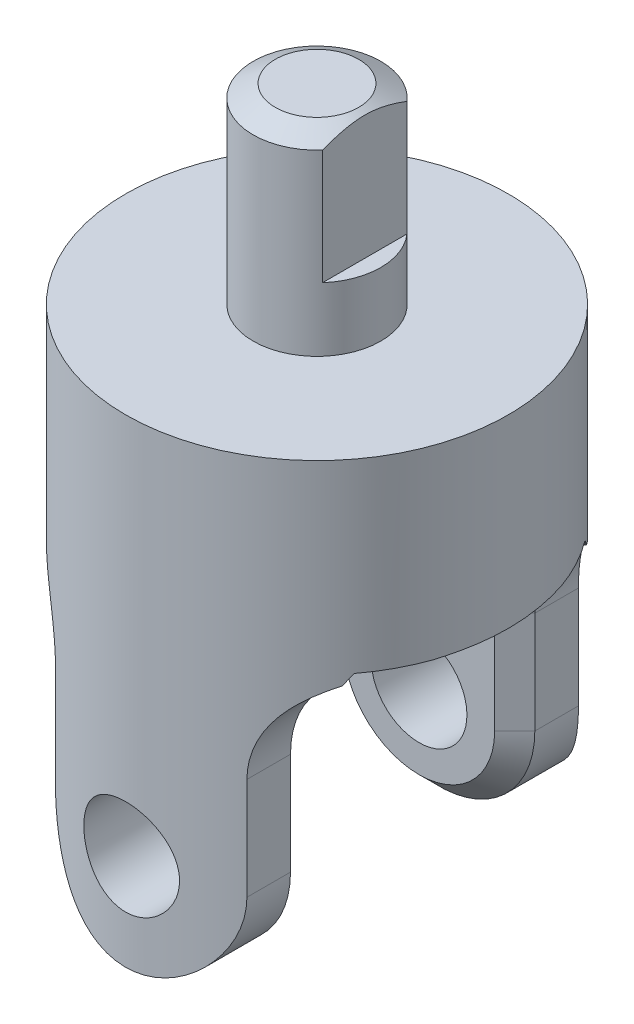
from build123d import *

# Parameters (mm, degrees)
SKETCH1_R               = 19.05
BASE_EXTRUDE_DEPTH      = 47.625
CUT_EXTRUDE1_DEPTH      = 55.716959208
CUT_EXTRUDE1_DEPTH_BACK = 55.716959208
CUT_EXTRUDE5_DEPTH      = 47.625
CUT_EXTRUDE5_DEPTH_BACK = 55.716959365
SKETCH8_W               = 20.32
SKETCH8_H               = 36.600526062
CUT_EXTRUDE6_DEPTH      = 55.716959365
CUT_EXTRUDE6_DEPTH_BACK = 55.716959365
SKETCH11_R              = 4.7625
SKETCH12_R              = 6.35
BOSS_EXTRUDE1_DEPTH     = 19.05
CHAMFER3_SIZE           = 1.27
CHAMFER3_SIZE2          = 2.199704526
CUT_EXTRUDE7_START      = -12.7
CUT_EXTRUDE7_DEPTH      = 12.7
CHAMFER4_SIZE           = 2


with BuildPart() as part:
    # Sketch1 → Base-Extrude (new body)
    with BuildSketch(Plane(origin=(0, 0, 0), x_dir=(-1, 0, 0), z_dir=(0, 1, 0))):
        with Locations(Location((0, 0, 0), (0, 0, 90))):
            Circle(SKETCH1_R)
    extrude(amount=BASE_EXTRUDE_DEPTH)

    # Sketch2 → Cut-Extrude1 (cut, two sides: drawn at the far end of the back side and taken through both)
    with BuildSketch(Plane.XY.offset(-CUT_EXTRUDE1_DEPTH_BACK)):
        with BuildLine():
            Line((9.525, 9.525), (9.525, 19.685))
            ThreePointArc((9.525, 19.685), (12.314807909, 26.420192091), (19.05, 29.21))
            Line((19.05, 29.21), (19.05, -1.366191125))
            Line((19.05, -1.366191125), (-19.05, -1.366191125))
            Line((-19.05, -1.366191125), (-19.05, 29.21))
            ThreePointArc((-19.05, 29.21), (-12.314807909, 26.420192091), (-9.525, 19.685))
            Line((-9.525, 19.685), (-9.525, 9.525))
            ThreePointArc((-9.525, 9.525), (0, 0), (9.525, 9.525))
        make_face()
    extrude(amount=CUT_EXTRUDE1_DEPTH + CUT_EXTRUDE1_DEPTH_BACK, mode=Mode.SUBTRACT)

    # Sketch8 → Cut-Extrude5 (cut, two sides: drawn at the far end of the back side and taken through both)
    with BuildSketch(Plane(origin=(0, 0, 0), x_dir=(0, 0, -1), z_dir=(1, 0, 0)).offset(-CUT_EXTRUDE5_DEPTH_BACK)):
        with Locations((0, 10.844975795)):
            Rectangle(SKETCH8_W, SKETCH8_H)
    extrude(amount=CUT_EXTRUDE5_DEPTH + CUT_EXTRUDE5_DEPTH_BACK, mode=Mode.SUBTRACT)

    # Sketch11 → Cut-Extrude6 (cut, two sides: drawn at the far end of the back side and taken through both)
    with BuildSketch(Plane.XY.offset(-CUT_EXTRUDE6_DEPTH_BACK)):
        with Locations(Location((0, 9.525, 0), (0, 0, 270))):
            Circle(SKETCH11_R)
    extrude(amount=CUT_EXTRUDE6_DEPTH + CUT_EXTRUDE6_DEPTH_BACK, mode=Mode.SUBTRACT)

    # Sketch12 → Boss-Extrude1 (add)
    with BuildSketch(Plane(origin=(0, 47.625, 0), x_dir=(-1, 0, 0), z_dir=(0, 1, 0))):
        with Locations(Location((0, 0, 0), (0, 0, 270))):
            Circle(SKETCH12_R)
    extrude(amount=BOSS_EXTRUDE1_DEPTH)

    # Chamfer3
    chamfer3_edges = [part.edges().sort_by_distance(p)[0] for p in [
        (0, 66.675, 6.35),
    ]]
    chamfer3_side = [part.faces().sort_by_distance(p)[0] for p in [
        (0, 57.15, 6.35),
    ]]
    chamfer(chamfer3_edges, length=CHAMFER3_SIZE, length2=CHAMFER3_SIZE2, reference=chamfer3_side[0])

    # Sketch13 → Cut-Extrude7 (cut)
    with BuildSketch(Plane(origin=(0, 66.675, 0), x_dir=(-1, 0, 0), z_dir=(0, 1, 0)).offset(CUT_EXTRUDE7_START)):
        with BuildLine():
            Line((-4.7625, 4.200130206), (-4.7625, -4.200130206))
            ThreePointArc((-4.7625, -4.200130206), (-6.35, 0), (-4.7625, 4.200130206))
        make_face()
    extrude(amount=CUT_EXTRUDE7_DEPTH, mode=Mode.SUBTRACT)

    # Chamfer4
    # the kernel refuses this chamfer: 2 mm, written as the material it takes off along each edge
    with BuildSketch(Plane(origin=(-19.05, 19.685, -10.16), x_dir=(-0.22489517574669296, 0.974382963688233, 0), z_dir=(-0.974382963688233, -0.22489517574669296, 0))) as chamfer4_piece_1_section:
        Polygon((9.525 + CHAMFER4_SIZE, 0), (9.525, CHAMFER4_SIZE), (9.525, 0), align=None)
    chamfer4_piece_1 = revolve(axis=Axis((-19.05, 19.685, -10.16), (0, 0, -1)), revolution_arc=102.996714199, mode=Mode.PRIVATE)
    chamfer4_piece_1 = split(chamfer4_piece_1, bisect_by=Plane(origin=(-11.833499513, 29.145238826, -10.859553491), z_dir=(0, -1, 0)), keep=Keep.TOP, mode=Mode.PRIVATE)
    add(chamfer4_piece_1, mode=Mode.SUBTRACT)
    with BuildSketch(Plane(origin=(-9.525, 19.685, -10.16), x_dir=(0.9996219169112968, 0, 0.027495876610586487), z_dir=(0, -1, 0)), Plane(origin=(9.525, 9.525, -10.16), x_dir=(-0.9996219169112968, 0, 0.027495876610586487), z_dir=(0, 1, 0)), Plane(origin=(-9.525, 9.525, 10.16), x_dir=(0.9996219169112968, 0, -0.027495876610586487), z_dir=(0, 1, 0))) as chamfer4_piece_2:
        Polygon((CHAMFER4_SIZE * 0.999621916911, -CHAMFER4_SIZE * 0.0274958766106), (-CHAMFER4_SIZE * 0.0274958766106, -CHAMFER4_SIZE * 0.999621916911), (0, 0), align=None)
    extrude(amount=10.16, mode=Mode.SUBTRACT)
    with BuildSketch(Plane(origin=(0, 9.525, -10.16), x_dir=(1, 0, 0), z_dir=(0, 1, 0))) as chamfer4_piece_3:
        Polygon((9.525 - CHAMFER4_SIZE, 0), (9.525, CHAMFER4_SIZE), (9.525, 0), align=None)
    revolve(axis=Axis((0, 9.525, -10.16), (0, 0, -1)), revolution_arc=180, mode=Mode.SUBTRACT)
    with BuildSketch(Plane(origin=(19.05, 19.685, -10.16), x_dir=(-1, 0, 0), z_dir=(0, -1, 0))) as chamfer4_piece_4_section:
        Polygon((9.525 + CHAMFER4_SIZE, 0), (9.525, CHAMFER4_SIZE), (9.525, 0), align=None)
    chamfer4_piece_4 = revolve(axis=Axis((19.05, 19.685, -10.16), (0, 0, -1)), revolution_arc=102.99671421, mode=Mode.PRIVATE)
    chamfer4_piece_4 = split(chamfer4_piece_4, bisect_by=Plane(origin=(8.94755814, 29.145238826, -10.725370549), z_dir=(0, -1, 0)), keep=Keep.TOP, mode=Mode.PRIVATE)
    add(chamfer4_piece_4, mode=Mode.SUBTRACT)
    with BuildSketch(Plane(origin=(-19.05, 19.685, 10.16), x_dir=(-0.2248951759500051, 0.9743829636413067, 0), z_dir=(-0.9743829636413067, -0.2248951759500051, 0))) as chamfer4_piece_5_section:
        Polygon((9.525 + CHAMFER4_SIZE, 0), (9.525, -CHAMFER4_SIZE), (9.525, 0), align=None)
    chamfer4_piece_5 = revolve(axis=Axis((-19.05, 19.685, 10.16), (0, 0, -1)), revolution_arc=102.99671421, mode=Mode.PRIVATE)
    chamfer4_piece_5 = split(chamfer4_piece_5, bisect_by=Plane(origin=(-11.833499521, 29.145238826, 10.859553492), z_dir=(0, -1, 0)), keep=Keep.TOP, mode=Mode.PRIVATE)
    add(chamfer4_piece_5, mode=Mode.SUBTRACT)
    with BuildSketch(Plane(origin=(0, 9.525, 10.16), x_dir=(1, 0, 0), z_dir=(0, 1, 0))) as chamfer4_piece_6:
        Polygon((9.525, -CHAMFER4_SIZE), (9.525 - CHAMFER4_SIZE, 0), (9.525, 0), align=None)
    revolve(axis=Axis((0, 9.525, 10.16), (0, 0, -1)), revolution_arc=180, mode=Mode.SUBTRACT)
    with BuildSketch(Plane(origin=(9.525, 19.685, 10.16), x_dir=(0.027495876610586487, 0, 0.9996219169112968), z_dir=(0, -1, 0))) as chamfer4_piece_7:
        Polygon((CHAMFER4_SIZE * 0.999621916911, CHAMFER4_SIZE * 0.0274958766106), (-CHAMFER4_SIZE * 0.0274958766106, CHAMFER4_SIZE * 0.999621916911), (0, 0), align=None)
    extrude(amount=10.16, mode=Mode.SUBTRACT)
    with BuildSketch(Plane(origin=(19.05, 19.685, 10.16), x_dir=(-1, 0, 0), z_dir=(0, -1, 0))) as chamfer4_piece_8_section:
        Polygon((9.525, -CHAMFER4_SIZE), (9.525 + CHAMFER4_SIZE, 0), (9.525, 0), align=None)
    chamfer4_piece_8 = revolve(axis=Axis((19.05, 19.685, 10.16), (0, 0, -1)), revolution_arc=102.996714199, mode=Mode.PRIVATE)
    chamfer4_piece_8 = split(chamfer4_piece_8, bisect_by=Plane(origin=(11.833499509, 29.145238826, 10.859553501), z_dir=(0, -1, 0)), keep=Keep.TOP, mode=Mode.PRIVATE)
    add(chamfer4_piece_8, mode=Mode.SUBTRACT)


solid = part.part
